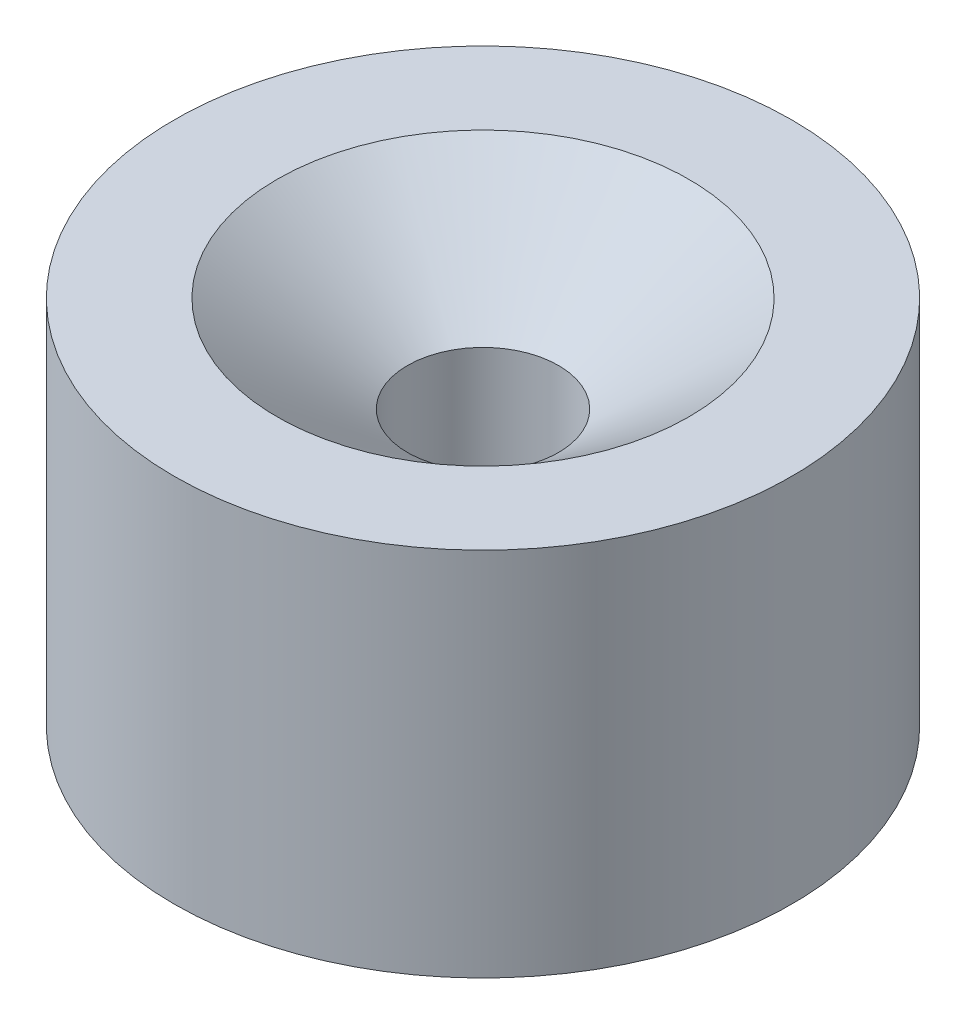
from build123d import *

# Parameters (mm, degrees)
SKETCH1_R           = 45
BOSS_EXTRUDE1_DEPTH = 54
SKETCH9_R           = 11
CUT_EXTRUDE1_DEPTH  = 76.166481892


with BuildPart() as part:
    # Sketch1 → Boss-Extrude1 (new body)
    with BuildSketch(Plane(origin=(0, 0, 0), x_dir=(1, 0, 0), z_dir=(0, 1, 0))):
        Circle(SKETCH1_R)
    extrude(amount=BOSS_EXTRUDE1_DEPTH)

    # Sketch8 → Cut-Revolve3 (revolve, cut)
    with BuildSketch(Plane.XY):
        Polygon((0, 54), (-30, 54), (-11, 40), (0, 40), align=None)
        Polygon((0, 0), (-30, 0), (-11, 14), (0, 14), align=None)
    revolve(axis=Axis((0, 0, 0), (0, 1, 0)), mode=Mode.SUBTRACT)

    # Sketch9 → Cut-Extrude1 (cut, through all)
    with BuildSketch(Plane(origin=(0, 40, 0), x_dir=(1, 0, 0), z_dir=(0, 1, 0))):
        Circle(SKETCH9_R)
    extrude(amount=-CUT_EXTRUDE1_DEPTH, mode=Mode.SUBTRACT)


solid = part.part
